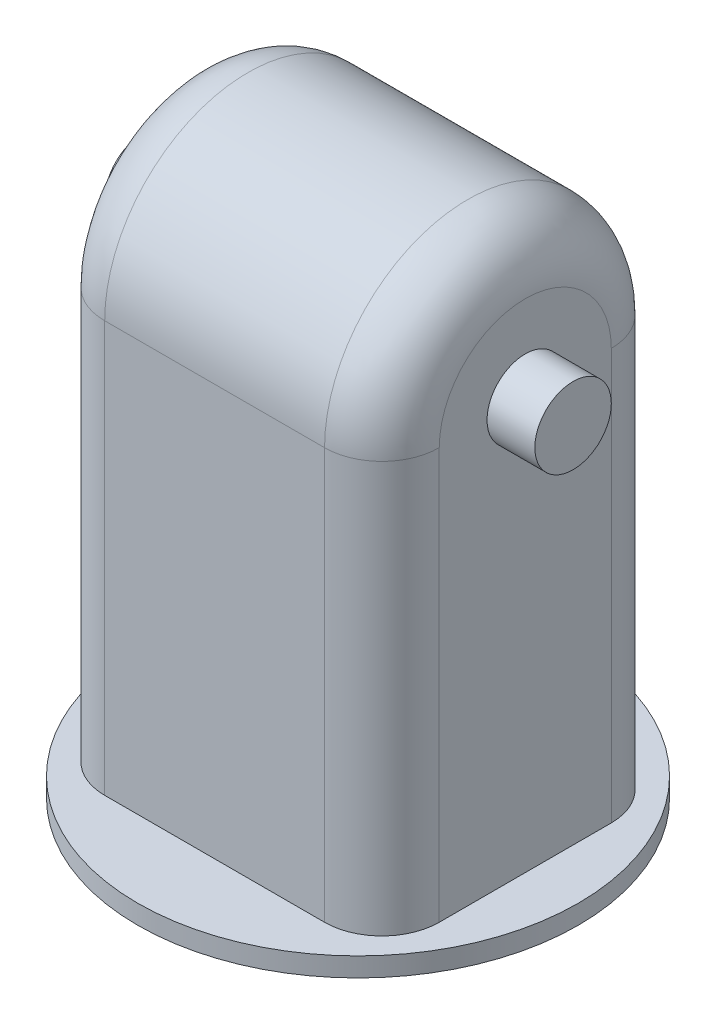
from build123d import *

# Parameters (mm, degrees)
SKETCH1_W           = 35
SKETCH1_H           = 30
BOSS_EXTRUDE1_DEPTH = 60
SKETCH2_R           = 4
BOSS_EXTRUDE2_DEPTH = 5
SKETCH4_R           = 23.048861143
BOSS_EXTRUDE3_DEPTH = 2
FILLET3_RADIUS      = 15
FILLET3_LENGTH      = 35
FILLET1_R           = 6
SKETCH7_R           = 5
BOSS_EXTRUDE4_DEPTH = 1


with BuildPart() as part:
    # Sketch1 → Boss-Extrude1 (new body)
    with BuildSketch(Plane(origin=(0, 0, 0), x_dir=(1, 0, 0), z_dir=(0, 1, 0))):
        Rectangle(SKETCH1_W, SKETCH1_H)
    extrude(amount=BOSS_EXTRUDE1_DEPTH)

    # Sketch2 → Boss-Extrude2 (add)
    with BuildSketch(Plane(origin=(17.5, 0, 0), x_dir=(0, 0, -1), z_dir=(1, 0, 0))):
        with Locations(Location((0, 45, 0), (0, 0, 180))):
            Circle(SKETCH2_R)
    boss_extrude2 = extrude(amount=BOSS_EXTRUDE2_DEPTH)

    # Mirror1: Boss-Extrude2 across plane
    add(boss_extrude2.mirror(Plane(origin=(0, 0, 0), x_dir=(0, 0, 1), z_dir=(1, 0, 0))))

    # Sketch4 → Boss-Extrude3 (add)
    with BuildSketch(Plane(origin=(0, 0, 0), x_dir=(1, 0, 0), z_dir=(0, 1, 0))):
        with Locations(Location((0, 0, 0), (0, 0, 40.601294645))):
            Circle(SKETCH4_R)
    extrude(amount=BOSS_EXTRUDE3_DEPTH)

    # Fillet3: full round fillet: the end face becomes a half cylinder, R = half its width
    fillet3_face = Plane((0, 60, 0), x_dir=(1, 0, 0), z_dir=(0, 1, 0))  # on the end face: x along it, z out of the body
    fillet3_slab = fillet3_face.offset(-FILLET3_RADIUS / 2) * Box(FILLET3_LENGTH, 2 * FILLET3_RADIUS, FILLET3_RADIUS, mode=Mode.PRIVATE)  # the body's end, R deep
    fillet3_round = Plane((0, 45, 0), x_dir=(0, 1, 0), z_dir=(1, 0, 0)) * Cylinder(FILLET3_RADIUS, FILLET3_LENGTH, mode=Mode.PRIVATE)  # its axis R under the face
    add(fillet3_slab - fillet3_round, mode=Mode.SUBTRACT)

    # Fillet1
    # the kernel refuses this fillet: 6 mm, written as the material it takes off along each edge
    with BuildSketch(Plane(origin=(-17.5, 2, 15), x_dir=(0, 0, -1), z_dir=(0, 1, 0)), Plane(origin=(17.5, 2, 15), x_dir=(-1, 0, 0), z_dir=(0, 1, 0)), Plane(origin=(17.5, 2, -15), x_dir=(0, 0, 1), z_dir=(0, 1, 0))) as fillet1_piece_1:
        with BuildLine():
            CenterArc((FILLET1_R, -FILLET1_R), FILLET1_R, 90, 90)
            Line((0, -FILLET1_R), (0, 0))
            Line((0, 0), (FILLET1_R, 0))
        make_face()
    extrude(amount=43, mode=Mode.SUBTRACT)
    with BuildSketch(Plane(origin=(-17.5, 2, -15), x_dir=(0, 0, 1), z_dir=(0, 1, 0))) as fillet1_piece_2:
        with BuildLine():
            CenterArc((FILLET1_R, FILLET1_R), FILLET1_R, 180, 90)
            Line((0, FILLET1_R), (0, 0))
            Line((0, 0), (FILLET1_R, 0))
        make_face()
    extrude(amount=43, mode=Mode.SUBTRACT)
    with BuildSketch(Plane(origin=(17.5, 45, 0), x_dir=(0, 0, -1), z_dir=(0, -1, 0))) as fillet1_piece_3:
        with BuildLine():
            CenterArc((15 - FILLET1_R, -FILLET1_R), FILLET1_R, 0, 90)
            Line((15, -FILLET1_R), (15, 0))
            Line((15, 0), (15 - FILLET1_R, 0))
        make_face()
    revolve(axis=Axis((17.5, 45, 0), (1, 0, 0)), revolution_arc=180, mode=Mode.SUBTRACT)
    with BuildSketch(Plane(origin=(-17.5, 45, 0), x_dir=(0, 0, 1), z_dir=(0, -1, 0))) as fillet1_piece_4:
        with BuildLine():
            CenterArc((15 - FILLET1_R, -FILLET1_R), FILLET1_R, 0, 90)
            Line((15, -FILLET1_R), (15, 0))
            Line((15, 0), (15 - FILLET1_R, 0))
        make_face()
    revolve(axis=Axis((-17.5, 45, 0), (-1, 0, 0)), revolution_arc=180, mode=Mode.SUBTRACT)

    # Sketch7 → Boss-Extrude4 (add)
    with BuildSketch(Plane.XZ):
        with Locations(Location((0, 0, 0), (0, 0, 270))):
            Circle(SKETCH7_R)
    extrude(amount=BOSS_EXTRUDE4_DEPTH)


solid = part.part
